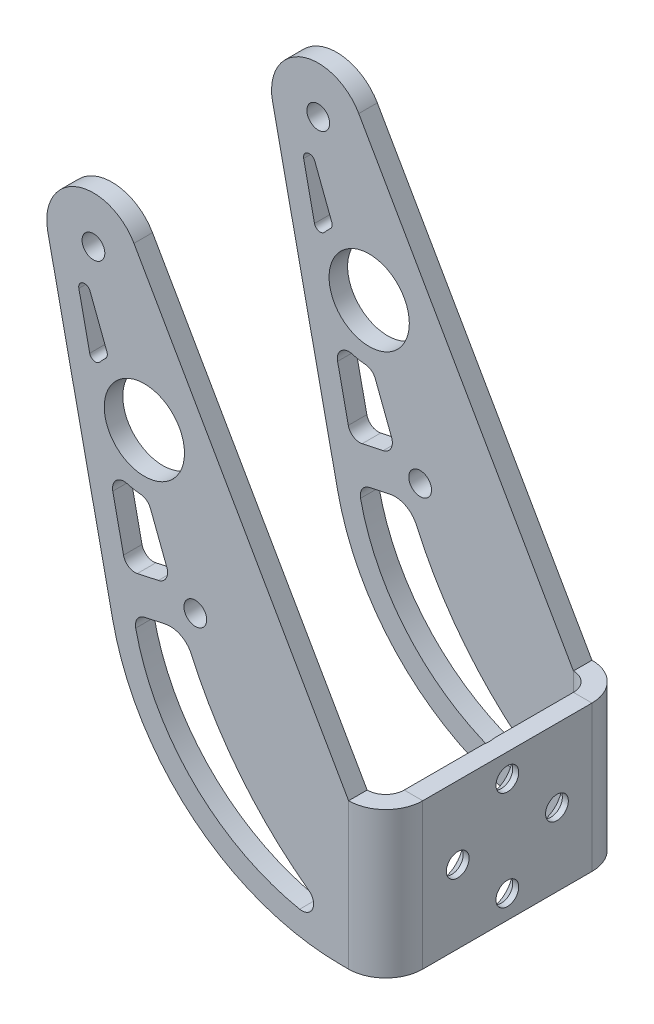
from build123d import *

# Parameters (mm, degrees)
SKETCH2_W                                      = 29
SKETCH2_H                                      = 25
BOSS_EXTRUDE1_DEPTH                            = 6.35
CONVERT_SOLID1_START                           = 3.175
CONVERT_SOLID1_OUTLINE_W                       = 25
CONVERT_SOLID1_OUTLINE_H                       = 29
CONVERT_SOLID1_DEPTH                           = 3.175
CSK_FOR_M3_5_FLAT_HEAD_MACHINE_SCREW1_AT_COUNT = 2
CSK_FOR_M3_5_FLAT_HEAD_MACHINE_SCREW1_AT_PITCH = 12.02081528
CSK_FOR_M3_5_FLAT_HEAD_MACHINE_SCREW_2_COUNT   = 2
CSK_FOR_M3_5_FLAT_HEAD_MACHINE_SCREW_2_PITCH   = 17
CSK_FOR_M3_5_FLAT_HEAD_MACHINE_SCREW_3_COUNT   = 2
CSK_FOR_M3_5_FLAT_HEAD_MACHINE_SCREW_3_PITCH   = 12.02081528
EDGE_FLANGE1_DEPTH                             = 25
EDGE_FLANGE1_BEND_DEPTH                        = 25
SKETCH23_R                                     = 1.95
SKETCH23_R_2                                   = 6.875
BOSS_EXTRUDE2_DEPTH                            = 3.175
FILLET1_R                                      = 40
SKETCH25_R                                     = 1.95
SKETCH25_R_2                                   = 6.875
CUT_EXTRUDE3_DEPTH                             = 107.260166637
FILLET2_R                                      = 2
FILLET3_R                                      = 4
FILLET4_R                                      = 1


with BuildPart() as part:
    # Sketch2 → Boss-Extrude1 (new body)
    with BuildSketch(Plane(origin=(0, 0, 0), x_dir=(0, 0, -1), z_dir=(1, 0, 0))):
        Rectangle(SKETCH2_W, SKETCH2_H)
    extrude(amount=BOSS_EXTRUDE1_DEPTH)

    # Convert-Solid1: read off the stored shape, not the designer's step
    # Convert-Solid1 outline → Convert-Solid1 (cut)
    with BuildSketch(Plane.YZ.offset(CONVERT_SOLID1_START)):
        Rectangle(CONVERT_SOLID1_OUTLINE_W, CONVERT_SOLID1_OUTLINE_H)
    extrude(amount=CONVERT_SOLID1_DEPTH, mode=Mode.SUBTRACT)

    # Sketch4 → CSK for M3.5 Flat Head Machine Screw1 (revolve, cut)
    with BuildSketch(Plane.ZX.offset(-8.5)):
        Polygon((0, 0), (0, 3.175), (1.95, 3.175), (1.95, 2.15), (4.1, 0), align=None)
    csk_for_m3_5_flat_head_machine_screw1 = revolve(axis=Axis((-6.35, -8.5, 0), (1, 0, 0)), mode=Mode.SUBTRACT)

    # CSK for M3.5 Flat Head Machine Screw1 at: CSK for M3.5 Flat Head Machine Screw1 ×2
    with Locations(*[Vector(0, 0.7071067811865476, 0.7071067811865476) * (i * CSK_FOR_M3_5_FLAT_HEAD_MACHINE_SCREW1_AT_PITCH) for i in range(1, CSK_FOR_M3_5_FLAT_HEAD_MACHINE_SCREW1_AT_COUNT)]):
        add(csk_for_m3_5_flat_head_machine_screw1, mode=Mode.SUBTRACT)

    # CSK for M3.5 Flat Head Machine Screw 2: CSK for M3.5 Flat Head Machine Screw1 ×2
    with Locations(*[(0, i * CSK_FOR_M3_5_FLAT_HEAD_MACHINE_SCREW_2_PITCH, 0) for i in range(1, CSK_FOR_M3_5_FLAT_HEAD_MACHINE_SCREW_2_COUNT)]):
        add(csk_for_m3_5_flat_head_machine_screw1, mode=Mode.SUBTRACT)

    # CSK for M3.5 Flat Head Machine Screw 3: CSK for M3.5 Flat Head Machine Screw1 ×2
    with Locations(*[Vector(0, 0.7071067811865476, -0.7071067811865476) * (i * CSK_FOR_M3_5_FLAT_HEAD_MACHINE_SCREW_3_PITCH) for i in range(1, CSK_FOR_M3_5_FLAT_HEAD_MACHINE_SCREW_3_COUNT)]):
        add(csk_for_m3_5_flat_head_machine_screw1, mode=Mode.SUBTRACT)

    # Edge-Flange1: sheet metal written as solids
    # Edge-Flange1 section (on a plane across the edge) → Edge-Flange1 (add)
    with BuildSketch(Plane(origin=(0, 12.5, -17.675), x_dir=(0, 0, 1), z_dir=(0, -1, 0))):
        with BuildLine():
            Line((-3.175, 3.175), (-3.175, 36.825))
            Line((-3.175, 36.825), (0, 36.825))
            Line((0, 36.825), (0, 3.175))
            ThreePointArc((0, 3.175), (0.92993597, 0.92993597), (3.175, 0))
            Line((3.175, 0), (3.175, -3.175))
            ThreePointArc((3.175, -3.175), (-1.315128061, -1.315128061), (-3.175, 3.175))
        make_face()
    extrude(amount=EDGE_FLANGE1_DEPTH)

    # Edge-Flange1 section 2 (on a plane across the edge) → Edge-Flange1 bend (add)
    with BuildSketch(Plane(origin=(0, -12.5, 17.675), x_dir=(0, 0, -1), z_dir=(0, 1, 0))):
        with BuildLine():
            Line((-3.175, 3.175), (-3.175, 36.825))
            Line((-3.175, 36.825), (0, 36.825))
            Line((0, 36.825), (0, 3.175))
            ThreePointArc((0, 3.175), (0.92993597, 0.92993597), (3.175, 0))
            Line((3.175, 0), (3.175, -3.175))
            ThreePointArc((3.175, -3.175), (-1.315128061, -1.315128061), (-3.175, 3.175))
        make_face()
    extrude(amount=EDGE_FLANGE1_BEND_DEPTH)

    # Sketch23 → Boss-Extrude2 (add)
    with BuildSketch(Plane.XY.offset(20.85)):
        with BuildLine():
            Line((-3.175, -12.5), (-3.175, 12.5))
            Line((-3.175, 12.5), (-39.960139618, 76.827855658))
            ThreePointArc((-39.960139618, 76.827855658), (-49.76125368, 80.329282617), (-54.727837027, 71.182978584))
            Line((-54.727837027, 71.182978584), (-36.825, -12.5))
            Line((-36.825, -12.5), (-3.175, -12.5))
        make_face()
        with Locations((-46.90485832, 72.856598659)):
            Circle(SKETCH23_R, mode=Mode.SUBTRACT)
        with Locations((-29.44514168, 27.179817962)):
            Circle(SKETCH23_R, mode=Mode.SUBTRACT)
        with Locations((-38.175, 50.01820831)):
            Circle(SKETCH23_R_2, mode=Mode.SUBTRACT)
    boss_extrude2 = extrude(amount=-BOSS_EXTRUDE2_DEPTH)

    # Mirror3: Boss-Extrude2 across plane
    add(boss_extrude2.mirror(Plane.XY))

    # Fillet1
    fillet1_edges = [part.edges().sort_by_distance(p)[0] for p in [
        (-36.825, -12.5, -19.2625),
        (-36.825, -12.5, 19.2625),
    ]]
    fillet(fillet1_edges, radius=FILLET1_R)

    # Sketch25 → Cut-Extrude3 (cut, through all)
    with BuildSketch(Plane.XY.offset(20.85)):
        with Locations((-46.90485832, 72.856598659)):
            Circle(SKETCH25_R)
        with Locations((-38.175, 50.01820831)):
            Circle(SKETCH25_R_2)
        with Locations((-29.44514168, 27.179817962)):
            Circle(SKETCH25_R)
        with BuildLine():
            Line((-40.030757762, 21.847284007), (-31.33001784, 23.708689176))
            ThreePointArc((-31.33001784, 23.708689176), (-22.681934441, 8.20199276), (-9.994811851, -4.219114299))
            ThreePointArc((-9.994811851, -4.219114299), (-9.344550797, -6.639671437), (-11.568981065, -7.794594065))
            ThreePointArc((-11.568981065, -7.794594065), (-30.444825945, 2.56631328), (-40.030757762, 21.847284007))
        make_face()
        with BuildLine():
            Line((-33.498088379, 29.38063017), (-37.618037608, 40.15892751))
            ThreePointArc((-37.618037608, 40.15892751), (-41.265614485, 40.639310342), (-44.484200888, 42.42152422))
            Line((-44.484200888, 42.42152422), (-41.335566751, 27.703908089))
            Line((-41.335566751, 27.703908089), (-33.498088379, 29.38063017))
        make_face()
        with BuildLine():
            Line((-44.336475361, 57.73519259), (-47.495065423, 65.998455308))
            ThreePointArc((-47.495065423, 65.998455308), (-48.713122103, 66.600238702), (-49.407023256, 65.432203379))
            Line((-49.407023256, 65.432203379), (-47.040106009, 54.368555475))
            ThreePointArc((-47.040106009, 54.368555475), (-45.874551823, 56.201453956), (-44.336475361, 57.73519259))
        make_face()
    extrude(amount=-CUT_EXTRUDE3_DEPTH, mode=Mode.SUBTRACT)

    # Fillet2
    fillet2_edges = [part.edges().sort_by_distance(p)[0] for p in [
        (-40.030757762, 21.847284007, 19.2625),
        (-40.030757762, 21.847284007, -19.2625),
        (-33.498088379, 29.38063017, 19.2625),
        (-41.335566751, 27.703908089, 19.2625),
        (-44.484200888, 42.42152422, 19.2625),
        (-37.618037608, 40.15892751, 19.2625),
        (-33.498088379, 29.38063017, -19.2625),
        (-41.335566751, 27.703908089, -19.2625),
        (-44.484200888, 42.42152422, -19.2625),
        (-37.618037608, 40.15892751, -19.2625),
    ]]
    fillet(fillet2_edges, radius=FILLET2_R)

    # Fillet3
    fillet3_edges = [part.edges().sort_by_distance(p)[0] for p in [
        (-31.33001784, 23.708689176, 19.2625),
        (-31.33001784, 23.708689176, -19.2625),
    ]]
    fillet(fillet3_edges, radius=FILLET3_R)

    # Fillet4
    fillet4_edges = [part.edges().sort_by_distance(p)[0] for p in [
        (-44.336475361, 57.73519259, 19.2625),
        (-47.040106009, 54.368555475, 19.2625),
        (-44.336475361, 57.73519259, -19.2625),
        (-47.040106009, 54.368555475, -19.2625),
    ]]
    fillet(fillet4_edges, radius=FILLET4_R)


solid = part.part
